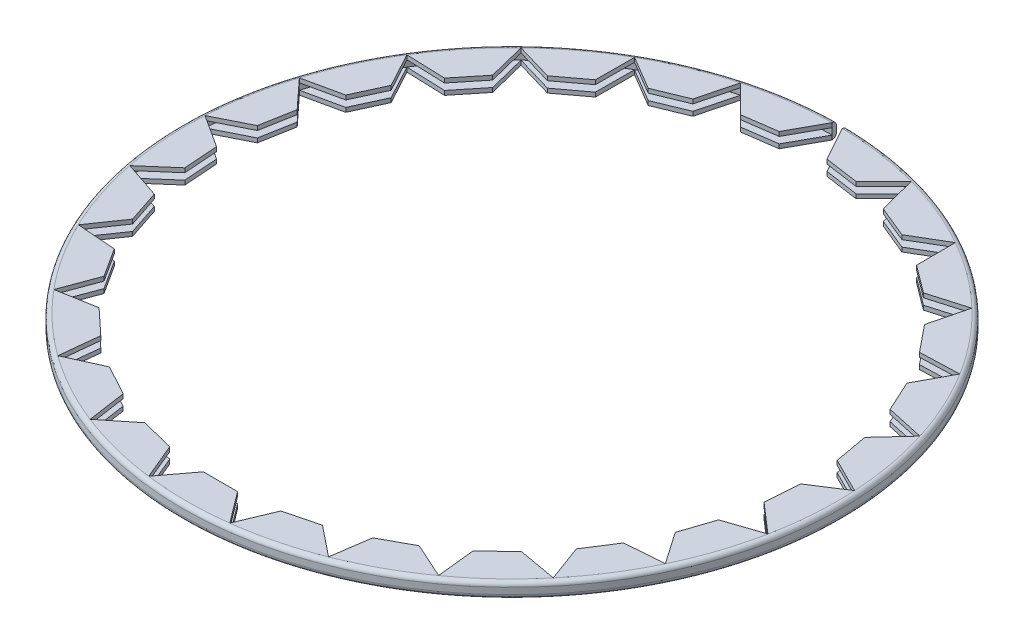
from build123d import *

# Parameters (mm, degrees)
SKETCH1_R           = 244.475
SKETCH1_R_2         = 241.3
BOSS_EXTRUDE1_DEPTH = 11.1125
SKETCH2_W           = 7.493
SKETCH2_H           = 52.802655163
CUT_EXTRUDE4_DEPTH  = 346.918399202
BOSS_EXTRUDE2_DEPTH = 11.1125
CIRPATTERN1_COUNT   = 25
CIRPATTERN1_ANGLE   = 343.8895
SKETCH4_W           = 50.8
SKETCH4_H           = 4.7625
FILLET1_R           = 3.175


with BuildPart() as part:
    # Sketch1 → Boss-Extrude1 (new body)
    with BuildSketch(Plane(origin=(0, 0, 0), x_dir=(1, 0, 0), z_dir=(0, 1, 0))):
        with Locations(Location((0, 0, 0), (0, 0, 270))):
            Circle(SKETCH1_R)
        with Locations(Location((0, 0, 0), (0, 0, 270))):
            Circle(SKETCH1_R_2, mode=Mode.SUBTRACT)
    extrude(amount=BOSS_EXTRUDE1_DEPTH)

    # Sketch2 → Cut-Extrude4 (cut, through all)
    with BuildSketch(Plane(origin=(0, 0, 0), x_dir=(1, 0, 0), z_dir=(0, 1, 0))):
        with Locations((0, 225.963866019)):
            Rectangle(SKETCH2_W, SKETCH2_H)
    extrude(amount=CUT_EXTRUDE4_DEPTH, mode=Mode.SUBTRACT)

    # Sketch3 → Boss-Extrude2 (add)
    with BuildSketch(Plane(origin=(0, 0, 0), x_dir=(1, 0, 0), z_dir=(0, 1, 0))):
        with BuildLine():
            Line((-3.7465, 241.270913576), (-17.734941554, 215.946899283))
            Line((-17.734941554, 215.946899283), (-42.884333935, 212.387677055))
            Line((-42.884333935, 212.387677055), (-63.350559943, 232.835556896))
            ThreePointArc((-63.350559943, 232.835556896), (-33.812611165, 238.919227619), (-3.7465, 241.270913576))
        make_face()
    boss_extrude2 = extrude(amount=BOSS_EXTRUDE2_DEPTH)

    # CirPattern1: Boss-Extrude2 ×25 about axis
    cirpattern1_axis = Axis((0, 0, 0), (0, 1, 0))
    for i in range(1, CIRPATTERN1_COUNT):
        add(boss_extrude2.rotate(cirpattern1_axis, i * CIRPATTERN1_ANGLE / (CIRPATTERN1_COUNT - 1)))

    # Sketch4 → Cut-Revolve1 (revolve, cut)
    with BuildSketch(Plane(origin=(0, 0, 0), x_dir=(0, 0, -1), z_dir=(1, 0, 0))):
        with Locations((215.9, 5.55625)):
            Rectangle(SKETCH4_W, SKETCH4_H)
    revolve(axis=Axis((0, 0, 0), (0, 1, 0)), mode=Mode.SUBTRACT)

    # Fillet1
    fillet1_edges = [part.edges().sort_by_distance(p)[0] for p in [
        (-244.467822736, 0, 1.873304996),
        (-244.467822736, 11.1125, 1.873304996),
    ]]
    fillet(fillet1_edges, radius=FILLET1_R - 0.0001)  # a hair under: the kernel refuses the full size


solid = part.part
